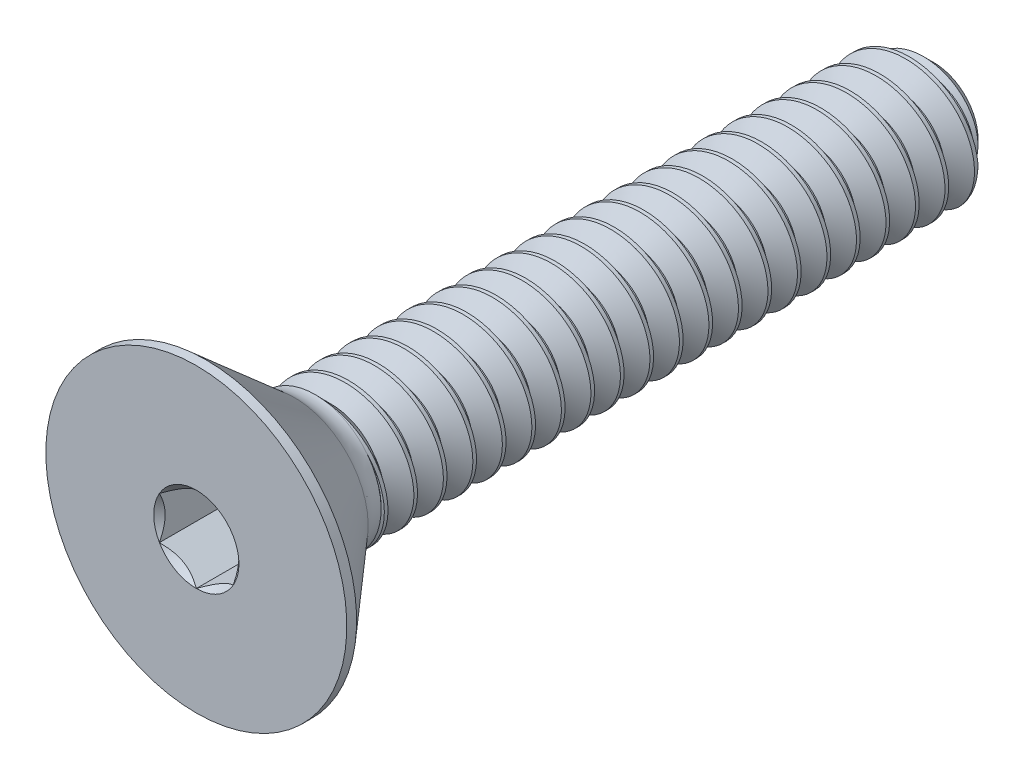
from build123d import *

# Parameters (mm, degrees)
SKETCH1_W          = 15.875
SKETCH1_H          = 1.4224
CHAMFER1_SIZE      = 0.47625
CUT_SWEEP1_PITCH   = 0.635
CUT_EXTRUDE2_DEPTH = 1.47574


with BuildPart() as part:
    # Sketch1 → Revolve1 (revolve)
    with BuildSketch(Plane(origin=(0, 0, 0), x_dir=(0, 0, -1), z_dir=(1, 0, 0))):
        with Locations((7.9375, 0.7112)):
            Rectangle(SKETCH1_W, SKETCH1_H)
    revolve(axis=Axis((0, 0, -15.875), (0, 0, 1)))

    # Chamfer1
    chamfer1_edges = [part.edges().sort_by_distance(p)[0] for p in [
        (0, -1.4224, -15.875),
    ]]
    chamfer(chamfer1_edges, length=CHAMFER1_SIZE)

    # Cut-Sweep1: the profile of Sketch2 profile screwed along a right-hand helix of 25 turns, 6 arcs to a turn; built about Z, then put on its axis
    cut_sweep1_z = Axis((0, 0, 0), (0, 0, 1))
    cut_sweep1_corners = [(1.4227, 0, 0.000173205), (1.4227, 0, -0.555798205), (1.009955401, 0, -0.3175), (1.009955401, 0, -0.238125)]
    with BuildLine(mode=Mode.PRIVATE) as cut_sweep1_profile:
        Line(cut_sweep1_corners[0], cut_sweep1_corners[1])
        Line(cut_sweep1_corners[1], cut_sweep1_corners[2])
        Line(cut_sweep1_corners[2], cut_sweep1_corners[3])
        Line(cut_sweep1_corners[3], cut_sweep1_corners[0])
    cut_sweep1_cap = Face(cut_sweep1_profile.wire())
    cut_sweep1_turn_angles = [0, 30, 60, 90, 120, 150, 180, 210, 240, 270, 300, 330, 360]
    cut_sweep1_turn_weights = [1, 0.8660254037844387, 1, 0.8660254037844387, 1, 0.8660254037844387, 1, 0.8660254037844387, 1, 0.8660254037844387, 1, 0.8660254037844387, 1]
    cut_sweep1_turn_rails = [Edge.make_bspline([Vector(p[0], p[1], 0).rotate(cut_sweep1_z, cut_sweep1_turn_angles[k]) / cut_sweep1_turn_weights[k] + Vector(0, 0, p[2] + CUT_SWEEP1_PITCH * cut_sweep1_turn_angles[k] / 360) for k in range(13)], [0, 0, 0, 1, 1, 2, 2, 3, 3, 4, 4, 5, 5, 6, 6, 6], 2, cut_sweep1_turn_weights) for p in cut_sweep1_corners]
    cut_sweep1_turn_sides = [Face.make_surface_from_curves(cut_sweep1_turn_rails[p[0]], cut_sweep1_turn_rails[p[1]]) for p in [(0, 1), (1, 2), (2, 3), (3, 0)]]
    cut_sweep1 = Plane(origin=(0, 0, -15.875), x_dir=(0, 1, 0), z_dir=(0, 0, 1)) * Solid(Shell([*[p.moved(Location((0, 0, CUT_SWEEP1_PITCH * i))) for i in range(25) for p in cut_sweep1_turn_sides], cut_sweep1_cap, cut_sweep1_cap.rotate(cut_sweep1_z, 9000).moved(Location((0, 0, CUT_SWEEP1_PITCH * 9000 / 360)))]))
    add(cut_sweep1, mode=Mode.SUBTRACT)

    # Sketch7 → Revolve2 (revolve)
    with BuildSketch(Plane(origin=(0, 0, 0), x_dir=(0, 0, -1), z_dir=(1, 0, 0)), mode=Mode.PRIVATE) as revolve2_sk:
        with BuildLine():
            Line((0, 3.2385), (0.21082, 3.2385))
            Line((0.21082, 3.2385), (2.1082, 1.589132729))
            ThreePointArc((2.1082, 1.589132729), (2.316098376, 1.465446193), (2.554146942, 1.4224))
            Line((2.554146942, 1.4224), (2.554146942, 0))
            Line((2.554146942, 0), (0, 0))
            Line((0, 0), (0, 3.2385))
        make_face()
    revolve(revolve2_sk.sketch.rotate(Axis((0, 0, 0), (0, 0, -1)), 189.336081704), axis=Axis((0, 0, 0), (0, 0, -1)))

    # Boss-Extrude1 cone 1 section (through the dimple's axis) → Boss-Extrude1 (revolve)
    with BuildSketch(Plane(origin=(0, 0, -2.554146942), x_dir=(0, -1, 0), z_dir=(1, 0, 0))):
        Polygon((0, 0), (1.4224, 0), (0, 1.397788587), align=None)
    revolve(axis=Axis((0, 0, -2.554146942), (0, 0, -1)))

    # Sketch5 → Cut-Extrude2 (cut)
    with BuildSketch(Plane.XY):
        Polygon((0.79375, -0.458271776), (0.79375, 0.458271776), (0, 0.916543552), (-0.79375, 0.458271776), (-0.79375, -0.458271776), (0, -0.916543552), align=None)
    extrude(amount=-CUT_EXTRUDE2_DEPTH, mode=Mode.SUBTRACT)

    # Cut-Extrude3 cone 1 section (through the dimple's axis) → Cut-Extrude3 (revolve, cut)
    with BuildSketch(Plane(origin=(0, 0, 0), x_dir=(0, -1, 0), z_dir=(1, 0, 0))):
        Polygon((0, 0), (0.916543552, 0), (0, 0.916543552), align=None)
    revolve(axis=Axis((0, 0, 0), (0, 0, -1)), mode=Mode.SUBTRACT)


solid = part.part
